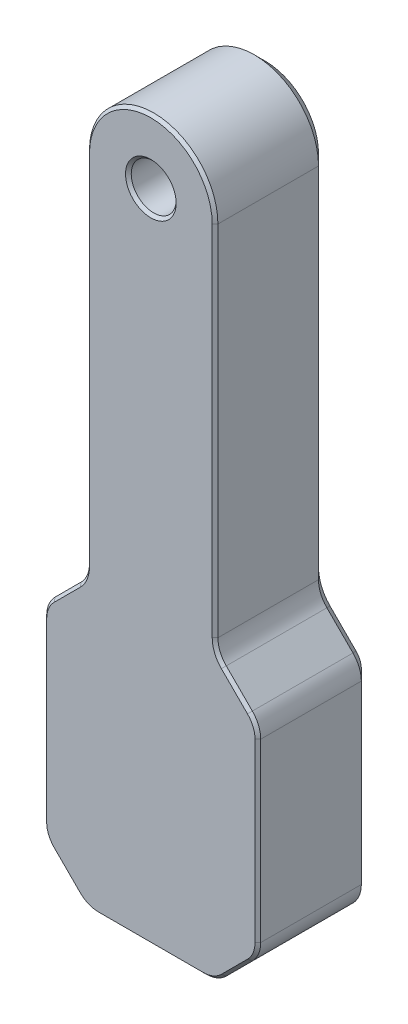
from build123d import *

# Parameters (mm, degrees)
BOSS_EXTRUDE2_DEPTH        = 8
LATCH_BUMP_ANGLE           = 90
LATCH_BUMP_OTHER_WAY_ANGLE = 90
PROFILE_FILLETS_R          = 2
SKETCH6_R                  = 2.875
COUNTERSINK_DEPTH          = 2.6
SKETCH7_R                  = 1.575
THROUGH_HOLE_DEPTH         = 48.225942773
DEBURS_SIZE                = 0.2
OUTSIDE_CHAMFER_SIZE       = 0.75


with BuildPart() as part:
    # Sketch1 → Boss-Extrude2 (new body)
    with BuildSketch(Plane.XY):
        with BuildLine():
            Line((-4.5, 0), (-4.5, -25.935168126))
            Line((-4.5, -25.935168126), (-7.5, -28.935168126))
            Line((-7.5, -28.935168126), (-7.5, -42.935168126))
            Line((-7.5, -42.935168126), (-4.5, -45.935168126))
            Line((-4.5, -45.935168126), (4.5, -45.935168126))
            Line((4.5, -45.935168126), (7.5, -42.935168126))
            Line((7.5, -42.935168126), (7.5, -28.935168126))
            Line((7.5, -28.935168126), (4.5, -25.935168126))
            Line((4.5, -25.935168126), (4.5, 0))
            ThreePointArc((4.5, 0), (0, 4.5), (-4.5, 0))
        make_face()
    extrude(amount=BOSS_EXTRUDE2_DEPTH)

    # Sketch8 → Latch  Bump (revolve)
    with BuildSketch(Plane.XY.offset(5)):
        with BuildLine():
            Line((-7.35, -39.935168126), (-7.35, -31.935168126))
            ThreePointArc((-7.35, -31.935168126), (-6.289339828, -32.374507955), (-5.85, -33.435168126))
            Line((-5.85, -33.435168126), (-5.85, -38.435168126))
            ThreePointArc((-5.85, -38.435168126), (-6.289339828, -39.495828298), (-7.35, -39.935168126))
        make_face()
    revolve(axis=Axis((-7.35, -39.935168126, 5), (0, 1, 0)), revolution_arc=LATCH_BUMP_ANGLE)

    # Sketch8 → Latch  Bump other way (revolve)
    with BuildSketch(Plane.XY.offset(5)):
        with BuildLine():
            Line((-7.35, -39.935168126), (-7.35, -31.935168126))
            ThreePointArc((-7.35, -31.935168126), (-6.289339828, -32.374507955), (-5.85, -33.435168126))
            Line((-5.85, -33.435168126), (-5.85, -38.435168126))
            ThreePointArc((-5.85, -38.435168126), (-6.289339828, -39.495828298), (-7.35, -39.935168126))
        make_face()
    revolve(axis=Axis((-7.35, -39.935168126, 5), (0, -1, 0)), revolution_arc=LATCH_BUMP_OTHER_WAY_ANGLE)

    # Profile Fillets
    profile_fillets_edges = [part.edges().sort_by_distance(p)[0] for p in [
        (-4.5, -25.935168126, 4),
        (-7.5, -28.935168126, 4),
        (-7.5, -42.935168126, 4),
        (-4.5, -45.935168126, 4),
        (4.5, -45.935168126, 4),
        (7.5, -42.935168126, 4),
        (7.5, -28.935168126, 4),
        (4.5, -25.935168126, 4),
    ]]
    fillet(profile_fillets_edges, radius=PROFILE_FILLETS_R)

    # Sketch6 → Countersink (cut)
    with BuildSketch(Plane(origin=(0, 0, 0), x_dir=(-1, 0, 0), z_dir=(0, 0, -1))):
        Circle(SKETCH6_R)
    extrude(amount=-COUNTERSINK_DEPTH, mode=Mode.SUBTRACT)

    # Sketch7 → Through Hole (cut, through all)
    with BuildSketch(Plane.XY):
        Circle(SKETCH7_R)
    extrude(amount=THROUGH_HOLE_DEPTH, mode=Mode.SUBTRACT)

    # Deburs
    deburs_edges = [part.edges().sort_by_distance(p)[0] for p in [
        (-1.575, 0, 8),
        (-1.575, 0, 2.6),
        (2.875, 0, 0),
        (0, 4.5, 8),
        (0, -45.935168126, 8),
        (4.43693974, -45.782927191, 8),
        (-4.43693974, -45.782927191, 8),
        (6, -44.435168126, 8),
        (-6, -44.435168126, 8),
        (7.347759065, -42.872107866, 8),
        (-7.347759065, -42.872107866, 8),
        (7.5, -35.935168126, 8),
        (-7.5, -35.935168126, 8),
        (7.347759065, -28.998228386, 8),
        (-7.347759065, -28.998228386, 8),
        (6, -27.435168126, 8),
        (-6, -27.435168126, 8),
        (4.652240935, -25.872107866, 8),
        (-4.652240935, -25.872107866, 8),
        (4.5, -12.553370501, 8),
        (-4.5, -12.553370501, 8),
    ]]
    chamfer(deburs_edges, length=DEBURS_SIZE)

    # Outside Chamfer
    outside_chamfer_edges = [part.edges().sort_by_distance(p)[0] for p in [
        (0, 4.5, 0),
        (-4.43693974, -45.782927191, 0),
        (0, -45.935168126, 0),
        (4.43693974, -45.782927191, 0),
        (6, -44.435168126, 0),
        (7.347759065, -42.872107866, 0),
        (7.5, -35.935168126, 0),
        (7.347759065, -28.998228386, 0),
        (6, -27.435168126, 0),
        (4.652240935, -25.872107866, 0),
        (4.5, -12.553370501, 0),
        (-4.5, -12.553370501, 0),
        (-4.652240935, -25.872107866, 0),
        (-6, -27.435168126, 0),
        (-7.347759065, -28.998228386, 0),
        (-7.5, -35.935168126, 0),
        (-7.347759065, -42.872107866, 0),
        (-6, -44.435168126, 0),
    ]]
    chamfer(outside_chamfer_edges, length=OUTSIDE_CHAMFER_SIZE)


solid = part.part
